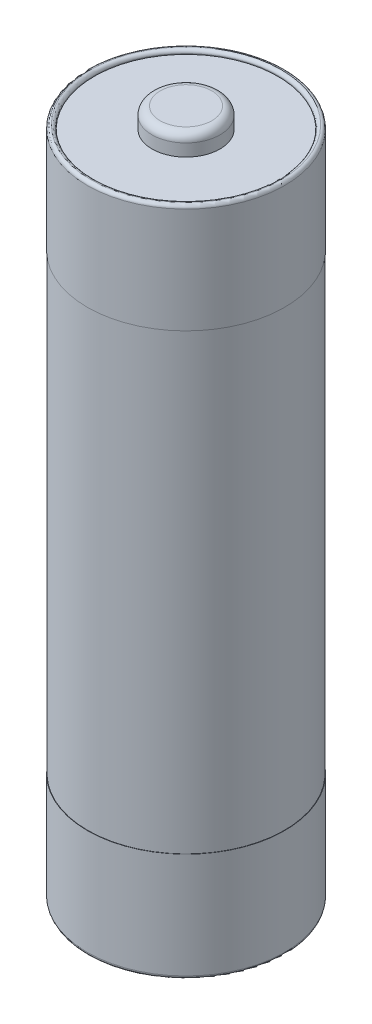
from build123d import *

# Parameters (mm, degrees)
SKETCH1_R           = 7.25
BOSS_EXTRUDE1_DEPTH = 8
SKETCH2_R           = 7.225
BOSS_EXTRUDE2_DEPTH = 33.3
SKETCH3_R           = 7.25
BOSS_EXTRUDE3_DEPTH = 8
SKETCH4_R           = 6.75
CUT_EXTRUDE1_DEPTH  = 0.3
SKETCH5_R           = 2.5
BOSS_EXTRUDE4_DEPTH = 1.5
CUT_EXTRUDE2_START  = -0.3
SKETCH6_R           = 6.75
CUT_EXTRUDE2_DEPTH  = 0.3
SKETCH7_R           = 3.5
BOSS_EXTRUDE5_DEPTH = 0.7
FILLET1_R           = 0.6
FILLET3_R           = 0.25
FILLET4_R           = 0.4
FILLET5_R           = 0.4


with BuildPart() as part:
    # Sketch1 → Boss-Extrude1 (new body)
    with BuildSketch(Plane(origin=(0, 0, 0), x_dir=(1, 0, 0), z_dir=(0, 1, 0))):
        with Locations(Location((0, 0, 0), (0, 0, 270))):
            Circle(SKETCH1_R)
    extrude(amount=BOSS_EXTRUDE1_DEPTH)

    # Sketch2 → Boss-Extrude2 (add)
    with BuildSketch(Plane(origin=(0, 8, 0), x_dir=(1, 0, 0), z_dir=(0, 1, 0))):
        with Locations(Location((0, 0, 0), (0, 0, 270))):
            Circle(SKETCH2_R)
    extrude(amount=BOSS_EXTRUDE2_DEPTH)

    # Sketch3 → Boss-Extrude3 (add)
    with BuildSketch(Plane(origin=(0, 41.3, 0), x_dir=(1, 0, 0), z_dir=(0, 1, 0))):
        with Locations(Location((0, 0, 0), (0, 0, 270))):
            Circle(SKETCH3_R)
    extrude(amount=BOSS_EXTRUDE3_DEPTH)

    # Sketch4 → Cut-Extrude1 (cut)
    with BuildSketch(Plane(origin=(0, 49.3, 0), x_dir=(1, 0, 0), z_dir=(0, 1, 0))):
        with Locations(Location((0, 0, 0), (0, 0, 270))):
            Circle(SKETCH4_R)
    extrude(amount=-CUT_EXTRUDE1_DEPTH, mode=Mode.SUBTRACT)

    # Sketch5 → Boss-Extrude4 (add)
    with BuildSketch(Plane(origin=(0, 49, 0), x_dir=(1, 0, 0), z_dir=(0, 1, 0))):
        with Locations(Location((0, 0, 0), (0, 0, 270))):
            Circle(SKETCH5_R)
    extrude(amount=BOSS_EXTRUDE4_DEPTH)

    # Sketch6 → Cut-Extrude2 (cut)
    with BuildSketch(Plane.XZ.offset(CUT_EXTRUDE2_START)):
        with Locations(Location((0, 0, 0), (0, 0, 90))):
            Circle(SKETCH6_R)
    extrude(amount=CUT_EXTRUDE2_DEPTH, mode=Mode.SUBTRACT)

    # Sketch7 → Boss-Extrude5 (add)
    with BuildSketch(Plane.XZ.offset(-0.3)):
        with Locations(Location((0, 0, 0), (0, 0, 270))):
            Circle(SKETCH7_R)
    extrude(amount=BOSS_EXTRUDE5_DEPTH)

    # Fillet1
    fillet1_edges = [part.edges().sort_by_distance(p)[0] for p in [
        (0, 50.5, -2.5),
    ]]
    fillet(fillet1_edges, radius=FILLET1_R)

    # Fillet3
    fillet3_edges = [part.edges().sort_by_distance(p)[0] for p in [
        (0, 49.3, -6.75),
        (0, 0, -7.25),
        (0, 0, -6.75),
        (0, 49.3, -7.25),
    ]]
    fillet(fillet3_edges, radius=FILLET3_R - 0.0001)  # a hair under: the kernel refuses the full size

    # Fillet4
    fillet4_edges = [part.edges().sort_by_distance(p)[0] for p in [
        (0, -0.4, 3.5),
    ]]
    fillet(fillet4_edges, radius=FILLET4_R)

    # Fillet5
    fillet5_edges = [part.edges().sort_by_distance(p)[0] for p in [
        (0, 0.3, 3.5),
    ]]
    fillet(fillet5_edges, radius=FILLET5_R)


solid = part.part
